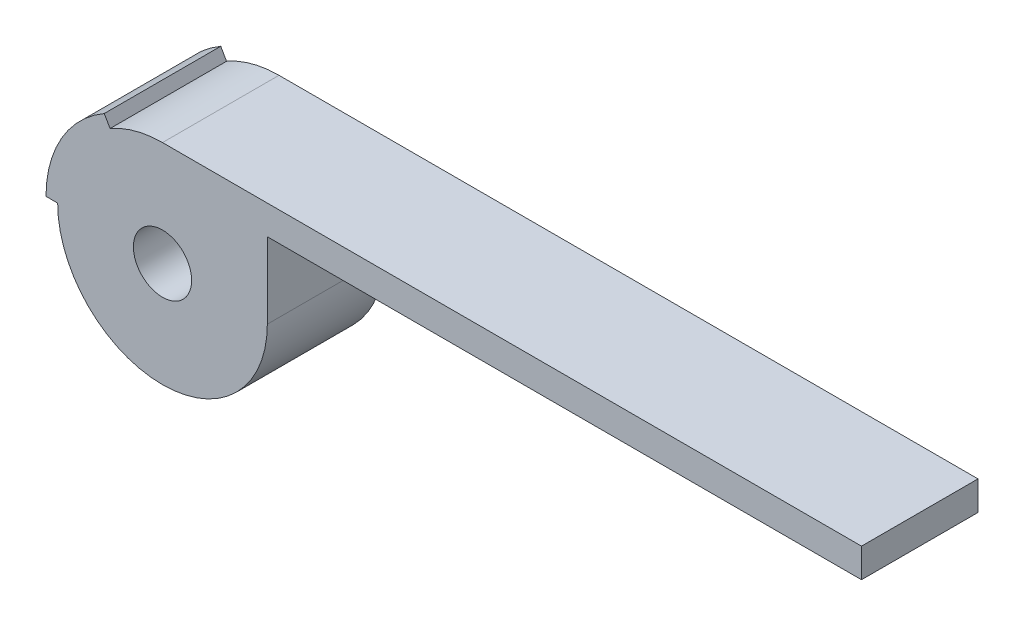
from build123d import *

# Parameters (mm, degrees)
SKETCH1_R           = 3.175
BOSS_EXTRUDE1_DEPTH = 12.7


with BuildPart() as part:
    # Sketch1 → Boss-Extrude1 (new body)
    with BuildSketch(Plane.XY):
        with BuildLine():
            Line((76.2, 11.43), (0, 11.43))
            ThreePointArc((0, 11.43), (-2.958301686, 11.040532194), (-5.715, 9.898670365))
            Line((-5.715, 9.898670365), (-6.35, 10.998522628))
            ThreePointArc((-6.35, 10.998522628), (-10.998522628, 6.35), (-12.7, 0))
            Line((-12.7, 0), (-11.43, 0))
            ThreePointArc((-11.43, 0), (0, -11.43), (11.43, 0))
            Line((11.43, 0), (11.43, 8.255))
            Line((11.43, 8.255), (76.2, 8.255))
            Line((76.2, 8.255), (76.2, 11.43))
        make_face()
        Circle(SKETCH1_R, mode=Mode.SUBTRACT)
    extrude(amount=BOSS_EXTRUDE1_DEPTH)


solid = part.part
